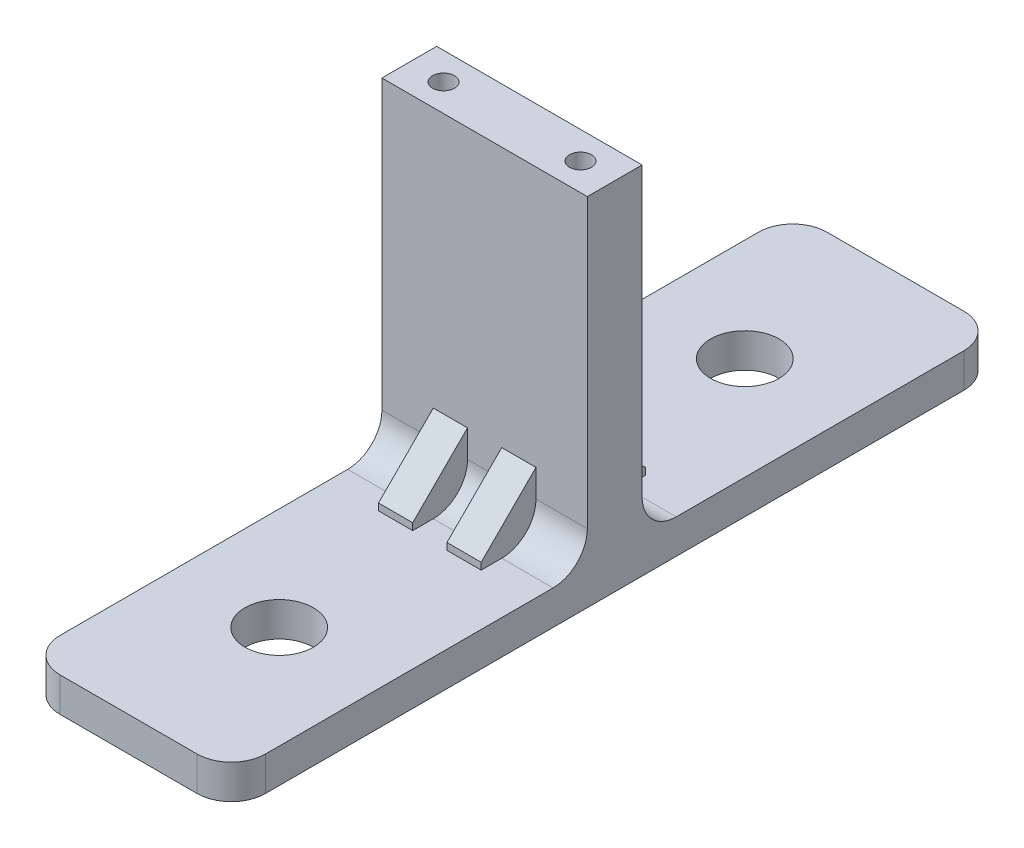
from build123d import *

# Parameters (mm, degrees)
SKETCH1_W                = 60
SKETCH1_H                = 5
BOSS_EXTRUDE1_DEPTH      = 30
SKETCH2_W                = 30
SKETCH2_H                = 8
BOSS_EXTRUDE2_DEPTH      = 47
SKETCH3_R                = 5
CUT_EXTRUDE1_DEPTH       = 82.908485519
SKETCH5_R                = 1.6
CUT_EXTRUDE3_DEPTH       = 14
FILLET1_R                = 5
FILLET2_R                = 5
SKETCH6_W                = 5
SKETCH6_H                = 5
SKETCH6_H_2              = 3
SKETCH6_H_3              = 8
BOSS_EXTRUDE3_DEPTH      = 9
CHAMFER1_SIZE            = 8
CHAMFER1_OF_MIRROR2_SIZE = 8


with BuildPart() as part:
    # Sketch1 → Boss-Extrude1 (new body)
    with BuildSketch(Plane(origin=(0, 0, 0), x_dir=(0, 0, -1), z_dir=(1, 0, 0))):
        with Locations((30, 2.5)):
            Rectangle(SKETCH1_W, SKETCH1_H)
    boss_extrude1 = extrude(amount=BOSS_EXTRUDE1_DEPTH)

    # Sketch2 → Boss-Extrude2 (add)
    with BuildSketch(Plane(origin=(0, 5, 0), x_dir=(1, 0, 0), z_dir=(0, 1, 0))):
        with Locations((15, 56)):
            Rectangle(SKETCH2_W, SKETCH2_H)
    extrude(amount=BOSS_EXTRUDE2_DEPTH)

    # Sketch3 → Cut-Extrude1 (cut, through all)
    with BuildSketch(Plane(origin=(0, 5, 0), x_dir=(1, 0, 0), z_dir=(0, 1, 0))):
        with Locations(Location((15, 22, 0), (0, 0, 270))):
            Circle(SKETCH3_R)
    cut_extrude1 = extrude(amount=-CUT_EXTRUDE1_DEPTH, mode=Mode.SUBTRACT)

    # Sketch5 → Cut-Extrude3 (cut)
    with BuildSketch(Plane(origin=(0, 52, 0), x_dir=(1, 0, 0), z_dir=(0, 1, 0))):
        with Locations(Location((5, 56, 0), (0, 0, 270))):
            Circle(SKETCH5_R)
        with Locations(Location((25, 56, 0), (0, 0, 270))):
            Circle(SKETCH5_R)
    extrude(amount=-CUT_EXTRUDE3_DEPTH, mode=Mode.SUBTRACT)

    # Fillet1
    fillet1_edges = [part.edges().sort_by_distance(p)[0] for p in [
        (15, 5, -52),
        (30, 2.5, 0),
        (0, 2.5, 0),
        (15, 0, -60),
    ]]
    fillet(fillet1_edges, radius=FILLET1_R)

    # Mirror1: Boss-Extrude1, Cut-Extrude1 across plane
    add(boss_extrude1.mirror(Plane(origin=(0, 0, -56), x_dir=(1, 0, 0), z_dir=(0, 0, -1))))
    add(cut_extrude1.mirror(Plane(origin=(0, 0, -56), x_dir=(1, 0, 0), z_dir=(0, 0, -1))), mode=Mode.SUBTRACT)

    # Fillet2
    fillet2_edges = [part.edges().sort_by_distance(p)[0] for p in [
        (15, 5, -60),
        (0, 2.5, -112),
        (30, 2.5, -112),
    ]]
    fillet(fillet2_edges, radius=FILLET2_R)

    # Sketch6 → Boss-Extrude3 (add)
    with BuildSketch(Plane(origin=(0, 5, 0), x_dir=(1, 0, 0), z_dir=(0, 1, 0))):
        with Locations((20, 49.5)):
            Rectangle(SKETCH6_W, SKETCH6_H)
        with Locations((20, 45.5)):
            Rectangle(SKETCH6_W, SKETCH6_H_2)
        with Locations((10, 48)):
            Rectangle(SKETCH6_W, SKETCH6_H_3)
    boss_extrude3 = extrude(amount=BOSS_EXTRUDE3_DEPTH)

    # Chamfer1
    chamfer1_edges = [part.edges().sort_by_distance(p)[0] for p in [
        (20, 14, -44),
        (10, 14, -44),
    ]]
    chamfer(chamfer1_edges, length=CHAMFER1_SIZE - 0.0001)  # a hair under: the kernel refuses the full size

    # Mirror2: Boss-Extrude3 across plane
    add(boss_extrude3.mirror(Plane(origin=(0, 0, -56), x_dir=(1, 0, 0), z_dir=(0, 0, -1))))

    # Chamfer1 of Mirror2
    chamfer1_of_mirror2_edges = [part.edges().sort_by_distance(p)[0] for p in [
        (20, 14, -68),
        (10, 14, -68),
    ]]
    chamfer(chamfer1_of_mirror2_edges, length=CHAMFER1_OF_MIRROR2_SIZE - 0.0001)  # a hair under: the kernel refuses the full size


solid = part.part
